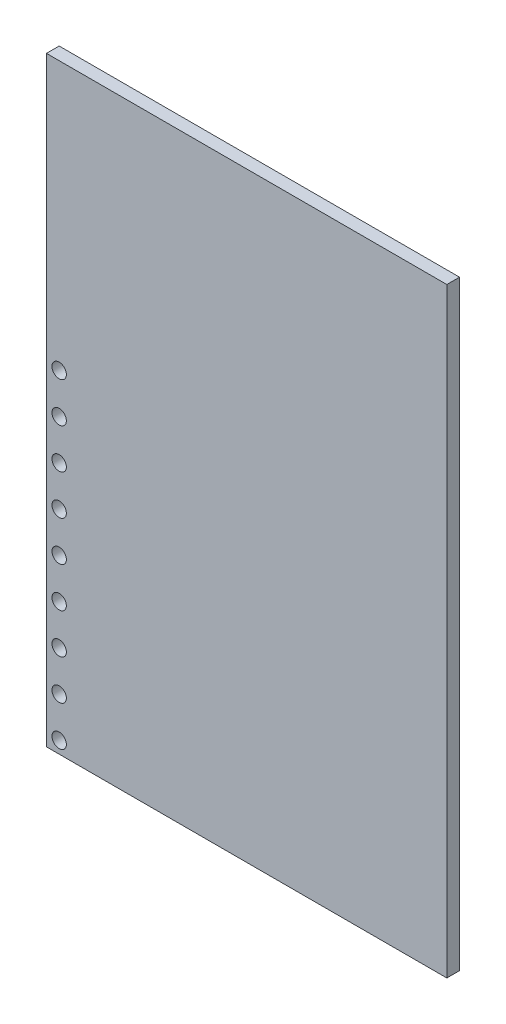
from build123d import *

# Parameters (mm, degrees)
SKETCH1_W           = 100
SKETCH1_H           = 3.175
BOSS_EXTRUDE1_DEPTH = 150
SKETCH2_R           = 1.8
CUT_EXTRUDE2_DEPTH  = 5
SKETCH2_14_R        = 1.8
CUT_EXTRUDE3_DEPTH  = 5
SKETCH2_15_R        = 1.8
CUT_EXTRUDE4_DEPTH  = 5
SKETCH2_16_R        = 1.8
CUT_EXTRUDE5_DEPTH  = 5
SKETCH2_17_R        = 1.8
CUT_EXTRUDE6_DEPTH  = 5
SKETCH2_18_R        = 1.8
CUT_EXTRUDE7_DEPTH  = 5
SKETCH2_19_R        = 1.8
CUT_EXTRUDE8_DEPTH  = 5
SKETCH2_20_R        = 1.8
CUT_EXTRUDE9_DEPTH  = 5
SKETCH2_21_R        = 1.8
CUT_EXTRUDE10_DEPTH = 5


with BuildPart() as part:
    # Sketch1 → Boss-Extrude1 (new body)
    with BuildSketch(Plane(origin=(0, 0, 0), x_dir=(1, 0, 0), z_dir=(0, 1, 0))):
        with Locations((50, 1.5875)):
            Rectangle(SKETCH1_W, SKETCH1_H)
    extrude(amount=BOSS_EXTRUDE1_DEPTH)

    # Sketch2 → Cut-Extrude2 (cut)
    with BuildSketch(Plane.XY):
        with Locations((3.175, 83)):
            Circle(SKETCH2_R)
    extrude(amount=-CUT_EXTRUDE2_DEPTH, mode=Mode.SUBTRACT)

    # Sketch2<14> → Cut-Extrude3 (cut)
    with BuildSketch(Plane.XY):
        with Locations((3.175, 73)):
            Circle(SKETCH2_14_R)
    extrude(amount=-CUT_EXTRUDE3_DEPTH, mode=Mode.SUBTRACT)

    # Sketch2<15> → Cut-Extrude4 (cut)
    with BuildSketch(Plane.XY):
        with Locations((3.175, 53)):
            Circle(SKETCH2_15_R)
    extrude(amount=-CUT_EXTRUDE4_DEPTH, mode=Mode.SUBTRACT)

    # Sketch2<16> → Cut-Extrude5 (cut)
    with BuildSketch(Plane.XY):
        with Locations((3.175, 63)):
            Circle(SKETCH2_16_R)
    extrude(amount=-CUT_EXTRUDE5_DEPTH, mode=Mode.SUBTRACT)

    # Sketch2<17> → Cut-Extrude6 (cut)
    with BuildSketch(Plane.XY):
        with Locations((3.175, 43)):
            Circle(SKETCH2_17_R)
    extrude(amount=-CUT_EXTRUDE6_DEPTH, mode=Mode.SUBTRACT)

    # Sketch2<18> → Cut-Extrude7 (cut)
    with BuildSketch(Plane.XY):
        with Locations((3.175, 33)):
            Circle(SKETCH2_18_R)
    extrude(amount=-CUT_EXTRUDE7_DEPTH, mode=Mode.SUBTRACT)

    # Sketch2<19> → Cut-Extrude8 (cut)
    with BuildSketch(Plane.XY):
        with Locations((3.175, 23)):
            Circle(SKETCH2_19_R)
    extrude(amount=-CUT_EXTRUDE8_DEPTH, mode=Mode.SUBTRACT)

    # Sketch2<20> → Cut-Extrude9 (cut)
    with BuildSketch(Plane.XY):
        with Locations((3.175, 13)):
            Circle(SKETCH2_20_R)
    extrude(amount=-CUT_EXTRUDE9_DEPTH, mode=Mode.SUBTRACT)

    # Sketch2<21> → Cut-Extrude10 (cut)
    with BuildSketch(Plane.XY):
        with Locations((3.175, 3)):
            Circle(SKETCH2_21_R)
    extrude(amount=-CUT_EXTRUDE10_DEPTH, mode=Mode.SUBTRACT)


solid = part.part
